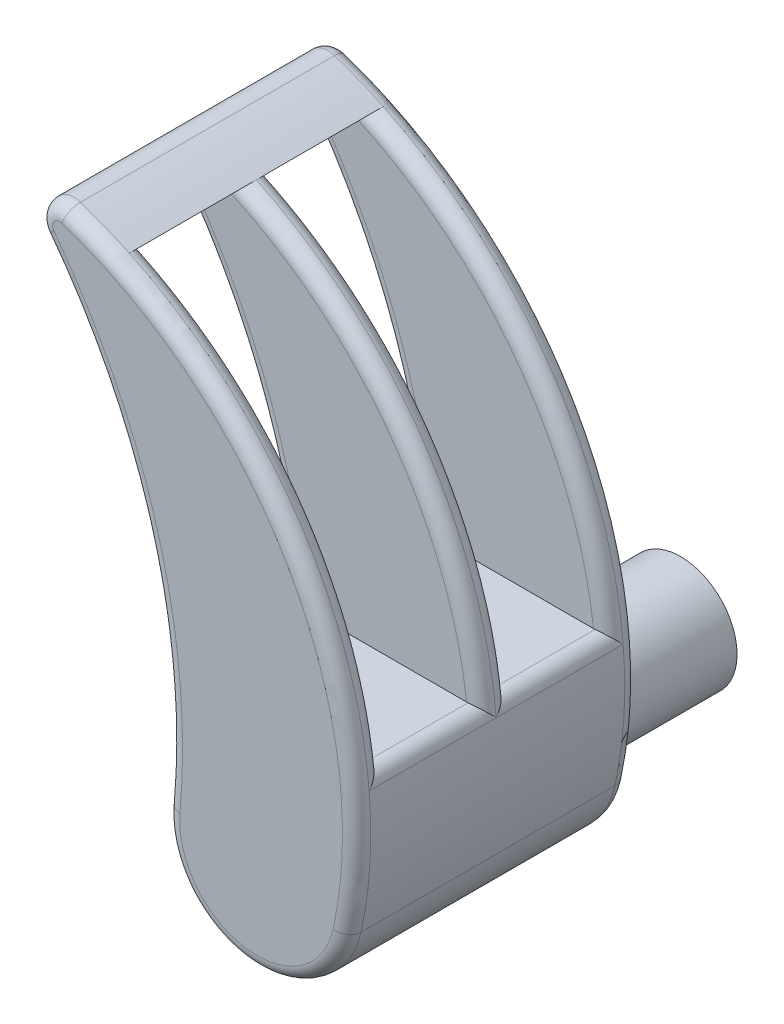
from build123d import *

# Parameters (mm, degrees)
SKETCH1_R                           = 2
BOSS_EXTRUDE1_DEPTH                 = 5
BOSS_EXTRUDE3_DEPTH                 = 10
CUT_EXTRUDE2_REACH                  = 25.802
CUT_EXTRUDE2_END_RADIUS             = 22.1288857330007
CUT_EXTRUDE2_DIRECTION_2_REACH      = 25.802
CUT_EXTRUDE2_DIRECTION_2_END_RADIUS = 14.999999999999998
FILLET5_R                           = 0.5


with BuildPart() as part:
    # Sketch1 → Boss-Extrude1 (new body)
    with BuildSketch(Plane.XY):
        Circle(SKETCH1_R)
    extrude(amount=BOSS_EXTRUDE1_DEPTH)

    # Sketch3 → Boss-Extrude3 (add)
    with BuildSketch(Plane.XY.offset(5)):
        with BuildLine():
            ThreePointArc((3.175585373226926, -0.6914893617021142), (-0.49178216220850224, -3.2125768947892164), (-3.2370218510524773, 0.2901543310185558))
            ThreePointArc((-3.2370218510524773, 0.2901543310185558), (-3.9981573872742686, 8.33829649509967), (-7.599161855032719, 15.576023100943765))
            ThreePointArc((-7.599161855032719, 15.576023100943765), (-7.609248419305821, 16.46453572535497), (-6.7641598682523645, 16.739093120803155))
            ThreePointArc((-6.7641598682523645, 16.739093120803155), (1.5493091336065543, 9.930479195240602), (3.175585373226926, -0.6914893617021142))
        make_face()
    extrude(amount=BOSS_EXTRUDE3_DEPTH)

    # Cut-Extrude2: up to this cylinder (the profile starts outside it)
    cut_extrude2_end = Plane(origin=(-25.277540822488355, 2.2657826498015, 10), z_dir=(0, 0, -1)) * Cylinder(CUT_EXTRUDE2_END_RADIUS, 101.3617714660014, mode=Mode.PRIVATE)
    # Sketch5 → Cut-Extrude2 (cut, up to the surface)
    with BuildSketch(Plane(origin=(0, 0, 0), x_dir=(0, 0, -1), z_dir=(1, 0, 0)), mode=Mode.PRIVATE) as cut_extrude2_sk1:
        Polygon((-13.999999999999998, 16.043695753790985), (-10.499999999999998, 16.043695753790985), (-10.499999999999998, 4.243695753790983), (-13.999999999999996, 4.243695753790984), align=None)
    cut_extrude2_tool1 = extrude(cut_extrude2_sk1.sketch, amount=-CUT_EXTRUDE2_REACH, mode=Mode.PRIVATE) - cut_extrude2_end
    add(cut_extrude2_tool1.solids().sort_by_distance((0, 10.143696, 12.25))[0], mode=Mode.SUBTRACT)
    # Sketch5 → Cut-Extrude2 (cut, up to the surface)
    with BuildSketch(Plane(origin=(0, 0, 0), x_dir=(0, 0, -1), z_dir=(1, 0, 0)), mode=Mode.PRIVATE) as cut_extrude2_sk2:
        Polygon((-9.500000000000002, 16.043695753790985), (-6.000000000000002, 16.04369575379098), (-6, 4.243695753790983), (-9.500000000000002, 4.243695753790983), align=None)
    cut_extrude2_tool2 = extrude(cut_extrude2_sk2.sketch, amount=-CUT_EXTRUDE2_REACH, mode=Mode.PRIVATE) - cut_extrude2_end
    add(cut_extrude2_tool2.solids().sort_by_distance((0, 10.143696, 7.75))[0], mode=Mode.SUBTRACT)

    # Cut-Extrude2 direction 2: up to this cylinder (the profile starts inside it)
    cut_extrude2_direction_2_end = Plane(origin=(-11.480962503205035, 2.5000000000000138, 10), z_dir=(0, 0, -1)) * Cylinder(CUT_EXTRUDE2_DIRECTION_2_END_RADIUS, 87.104, mode=Mode.PRIVATE)
    # Sketch5 → Cut-Extrude2 direction 2 (cut, up to the surface)
    with BuildSketch(Plane(origin=(0, 0, 0), x_dir=(0, 0, -1), z_dir=(1, 0, 0)), mode=Mode.PRIVATE) as cut_extrude2_direction_2_sk1:
        Polygon((-13.999999999999998, 16.043695753790985), (-10.499999999999998, 16.043695753790985), (-10.499999999999998, 4.243695753790983), (-13.999999999999996, 4.243695753790984), align=None)
    cut_extrude2_direction_2_tool1 = extrude(cut_extrude2_direction_2_sk1.sketch, amount=CUT_EXTRUDE2_DIRECTION_2_REACH, mode=Mode.PRIVATE) & cut_extrude2_direction_2_end
    add(cut_extrude2_direction_2_tool1.solids().sort_by_distance((0, 10.143696, 12.25))[0], mode=Mode.SUBTRACT)
    # Sketch5 → Cut-Extrude2 direction 2 (cut, up to the surface)
    with BuildSketch(Plane(origin=(0, 0, 0), x_dir=(0, 0, -1), z_dir=(1, 0, 0)), mode=Mode.PRIVATE) as cut_extrude2_direction_2_sk2:
        Polygon((-9.500000000000002, 16.043695753790985), (-6.000000000000002, 16.04369575379098), (-6, 4.243695753790983), (-9.500000000000002, 4.243695753790983), align=None)
    cut_extrude2_direction_2_tool2 = extrude(cut_extrude2_direction_2_sk2.sketch, amount=CUT_EXTRUDE2_DIRECTION_2_REACH, mode=Mode.PRIVATE) & cut_extrude2_direction_2_end
    add(cut_extrude2_direction_2_tool2.solids().sort_by_distance((0, 10.143696, 7.75))[0], mode=Mode.SUBTRACT)

    # Fillet5
    # the kernel refuses this fillet: 0.5 mm, written as the material it takes off along each edge
    with BuildSketch(Plane(origin=(-7.000000000000001, 16.027138464762995, 14), x_dir=(-0.7988824733769542, -0.6014871517589715, 0), z_dir=(0.6014871517589715, -0.7988824733769542, 0))) as fillet5_piece_1_section:
        with BuildLine():
            CenterArc((0.7500000000000029 - FILLET5_R, -FILLET5_R), FILLET5_R, 0, 90)
            Line((0.7500000000000029 - FILLET5_R, 0), (0.7500000000000029, 0))
            Line((0.7500000000000029, 0), (0.7500000000000029, -FILLET5_R))
        make_face()
    fillet5_piece_1 = revolve(axis=Axis((-7.000000000000001, 16.027138464762995, 14), (0, 0, -1)), revolution_arc=133.74135793171683, mode=Mode.PRIVATE)
    fillet5_piece_1 = split(fillet5_piece_1, bisect_by=Plane(origin=(-7.611530655795485, 16.043695753790985, 14.123559013641222), z_dir=(0, -1, 0)), keep=Keep.TOP, mode=Mode.PRIVATE)
    add(fillet5_piece_1, mode=Mode.SUBTRACT)
    with BuildSketch(Plane(origin=(-7.000000000000001, 16.027138464762995, 6.000000000000002), x_dir=(-0.7988824733769542, -0.6014871517589715, 0), z_dir=(0.6014871517589715, -0.7988824733769542, 0))) as fillet5_piece_2_section:
        with BuildLine():
            CenterArc((0.7500000000000029 - FILLET5_R, FILLET5_R), FILLET5_R, 269.9999999999999, 90.00000000000011)
            Line((0.7500000000000029 - FILLET5_R, 0), (0.7500000000000029, 0))
            Line((0.7500000000000029, 0), (0.7500000000000029, FILLET5_R))
        make_face()
    fillet5_piece_2 = revolve(axis=Axis((-7.000000000000001, 16.027138464762995, 6.000000000000002), (0, 0, -1)), revolution_arc=133.7413579317162, mode=Mode.PRIVATE)
    fillet5_piece_2 = split(fillet5_piece_2, bisect_by=Plane(origin=(-7.611530654842534, 16.04369575379098, 5.876440985070449), z_dir=(0, -1, 1.02e-15)), keep=Keep.TOP, mode=Mode.PRIVATE)
    add(fillet5_piece_2, mode=Mode.SUBTRACT)
    with BuildSketch(Plane(origin=(-7.000000000000001, 16.027138464762995, 9.500000000000002), x_dir=(-0.7988824733769542, -0.6014871517589715, 0), z_dir=(0.6014871517589715, -0.7988824733769542, 0))) as fillet5_piece_3_section:
        with BuildLine():
            CenterArc((0.7500000000000029 - FILLET5_R, -FILLET5_R), FILLET5_R, 0, 90.00000000000013)
            Line((0.7500000000000029 - FILLET5_R, 0), (0.7500000000000029, 0))
            Line((0.7500000000000029, 0), (0.7500000000000029, -FILLET5_R))
        make_face()
    fillet5_piece_3 = revolve(axis=Axis((-7.000000000000001, 16.027138464762995, 9.500000000000002), (0, 0, -1)), revolution_arc=133.7413579317169, mode=Mode.PRIVATE)
    fillet5_piece_3 = split(fillet5_piece_3, bisect_by=Plane(origin=(-7.6115306557954865, 16.043695753790985, 9.623559013641223), z_dir=(0, -1, 1.02e-15)), keep=Keep.TOP, mode=Mode.PRIVATE)
    add(fillet5_piece_3, mode=Mode.SUBTRACT)
    with BuildSketch(Plane(origin=(-7.000000000000001, 16.027138464762995, 10.499999999999998), x_dir=(-0.7988824733769542, -0.6014871517589715, 0), z_dir=(0.6014871517589715, -0.7988824733769542, 0))) as fillet5_piece_4_section:
        with BuildLine():
            CenterArc((0.7500000000000029 - FILLET5_R, FILLET5_R), FILLET5_R, 270, 90)
            Line((0.7500000000000029 - FILLET5_R, 0), (0.7500000000000029, 0))
            Line((0.7500000000000029, 0), (0.7500000000000029, FILLET5_R))
        make_face()
    fillet5_piece_4 = revolve(axis=Axis((-7.000000000000001, 16.027138464762995, 10.499999999999998), (0, 0, -1)), revolution_arc=133.74135793171683, mode=Mode.PRIVATE)
    fillet5_piece_4 = split(fillet5_piece_4, bisect_by=Plane(origin=(-7.611530654842534, 16.043695753790985, 10.376440985070444), z_dir=(0, -1, 0)), keep=Keep.TOP, mode=Mode.PRIVATE)
    add(fillet5_piece_4, mode=Mode.SUBTRACT)
    with BuildSketch(Plane(origin=(-7.000000000000001, 16.027138464762995, 5), x_dir=(-0.7988824733769542, -0.6014871517589715, 0), z_dir=(0.6014871517589715, -0.7988824733769542, 0))) as fillet5_piece_5:
        with BuildLine():
            CenterArc((0.7500000000000029 - FILLET5_R, -FILLET5_R), FILLET5_R, 0, 90.00000000000009)
            Line((0.7500000000000029 - FILLET5_R, 0), (0.7500000000000029, 0))
            Line((0.7500000000000029, 0), (0.7500000000000029, -FILLET5_R))
        make_face()
    revolve(axis=Axis((-7.000000000000001, 16.027138464762995, 5), (0, 0, -1)), revolution_arc=145.30430724960047, mode=Mode.SUBTRACT)
    with BuildSketch(Plane(origin=(-11.480962503205046, 2.4999999999999982, 5), x_dir=(0.3144535089968451, 0.9492728747202097, 0), z_dir=(-0.9492728747202097, 0.3144535089968451, 0))) as fillet5_piece_6:
        with BuildLine():
            CenterArc((15.00000000000001 - FILLET5_R, -FILLET5_R), FILLET5_R, 0, 90)
            Line((15.00000000000001, -FILLET5_R), (15.00000000000001, 0))
            Line((15.00000000000001, 0), (15.00000000000001 - FILLET5_R, 0))
        make_face()
    revolve(axis=Axis((-11.480962503205046, 2.4999999999999982, 5), (0, 0, -1)), revolution_arc=83.95666806488748, mode=Mode.SUBTRACT)
    with BuildSketch(Plane(origin=(-2.44e-15, 4.11e-15, 5), x_dir=(0.9771031917621312, -0.2127659574468055, 0), z_dir=(0.2127659574468055, 0.9771031917621312, 0))) as fillet5_piece_7:
        with BuildLine():
            CenterArc((3.250000000000003 - FILLET5_R, -FILLET5_R), FILLET5_R, 0, 90)
            Line((3.250000000000003 - FILLET5_R, 0), (3.250000000000003, 0))
            Line((3.250000000000003, 0), (3.250000000000003, -FILLET5_R))
        make_face()
    revolve(axis=Axis((-2.44e-15, 4.11e-15, 5), (0, 0, -1)), revolution_arc=172.8375931843419, mode=Mode.SUBTRACT)
    with BuildSketch(Plane(origin=(-2.44e-15, 4.11e-15, 15), x_dir=(0.9771031917621312, -0.2127659574468055, 0), z_dir=(0.2127659574468055, 0.9771031917621312, 0))) as fillet5_piece_8:
        with BuildLine():
            CenterArc((3.250000000000003 - FILLET5_R, FILLET5_R), FILLET5_R, 270, 90)
            Line((3.250000000000003 - FILLET5_R, 0), (3.250000000000003, 0))
            Line((3.250000000000003, 0), (3.250000000000003, FILLET5_R))
        make_face()
    revolve(axis=Axis((-2.44e-15, 4.11e-15, 15), (0, 0, -1)), revolution_arc=172.8375931843419, mode=Mode.SUBTRACT)
    with BuildSketch(Plane(origin=(-25.277540822488493, 2.2657826498014497, 15), x_dir=(0.9960067234007614, -0.08927825569801, 0), z_dir=(-0.08927825569801, -0.9960067234007614, 0))) as fillet5_piece_9:
        with BuildLine():
            CenterArc((22.128885733000832 + FILLET5_R, -FILLET5_R), FILLET5_R, 90, 90)
            Line((22.128885733000832, -FILLET5_R), (22.128885733000832, 0))
            Line((22.128885733000832, 0), (22.128885733000832 + FILLET5_R, 0))
        make_face()
    revolve(axis=Axis((-25.277540822488493, 2.2657826498014497, 15), (0, 0, 1)), revolution_arc=42.09856849882899, mode=Mode.SUBTRACT)
    with BuildSketch(Plane(origin=(-7.000000000000001, 16.027138464762995, 15), x_dir=(-0.7988824733769542, -0.6014871517589715, 0), z_dir=(0.6014871517589715, -0.7988824733769542, 0))) as fillet5_piece_10:
        with BuildLine():
            CenterArc((0.7500000000000029 - FILLET5_R, FILLET5_R), FILLET5_R, 270, 90)
            Line((0.7500000000000029, FILLET5_R), (0.7500000000000029, 0))
            Line((0.7500000000000029, 0), (0.7500000000000029 - FILLET5_R, 0))
        make_face()
    revolve(axis=Axis((-7.000000000000001, 16.027138464762995, 15), (0, 0, -1)), revolution_arc=145.30430724960047, mode=Mode.SUBTRACT)
    with BuildSketch(Plane(origin=(-11.480962503205046, 2.4999999999999982, 15), x_dir=(0.3144535089968451, 0.9492728747202097, 0), z_dir=(-0.9492728747202097, 0.3144535089968451, 0))) as fillet5_piece_11:
        with BuildLine():
            CenterArc((15.00000000000001 - FILLET5_R, FILLET5_R), FILLET5_R, 270, 90)
            Line((15.00000000000001, FILLET5_R), (15.00000000000001, 0))
            Line((15.00000000000001, 0), (15.00000000000001 - FILLET5_R, 0))
        make_face()
    revolve(axis=Axis((-11.480962503205046, 2.4999999999999982, 15), (0, 0, -1)), revolution_arc=83.95666806488748, mode=Mode.SUBTRACT)
    with BuildSketch(Plane(origin=(-25.277540822488355, 2.2657826498015, 13.999999999999993), x_dir=(0.7988824733769484, 0.601487151758979, 0), z_dir=(-0.601487151758979, 0.7988824733769484, 0))) as fillet5_piece_12_section:
        with BuildLine():
            CenterArc((22.1288857330007 + FILLET5_R, -FILLET5_R), FILLET5_R, 90, 89.99999999999937)
            Line((22.128885733000697, -FILLET5_R), (22.1288857330007, 0))
            Line((22.1288857330007, 0), (22.1288857330007 + FILLET5_R, -5.33e-15))
        make_face()
    fillet5_piece_12 = revolve(axis=Axis((-25.277540822488355, 2.2657826498015, 13.999999999999993), (0, 0, -1)), revolution_arc=35.085098986813165, mode=Mode.PRIVATE)
    fillet5_piece_12 = split(fillet5_piece_12, bisect_by=Plane(origin=(-4.487192939140403, 4.243695753790984, 14.139913107038728), z_dir=(0, 1, -2.5e-16)), keep=Keep.TOP, mode=Mode.PRIVATE)
    add(fillet5_piece_12, mode=Mode.SUBTRACT)
    with BuildSketch(Plane(origin=(-3.2372267698876485, 4.243695753790983, 10.850645451248859), x_dir=(1, 0, 0), z_dir=(0, 0, -1))) as fillet5_piece_13_section:
        with BuildLine():
            CenterArc((0.5402581804995541, 0.5), FILLET5_R, 176.2552951332616, 93.7447048667384)
            ThreePointArc((0.04132569881376735, 0.5326554546571032), (0.02227039096021244, 0.26620300734777746), (0, 0))
            Line((0, 0), (0.5402581804995541, 0))
        make_face()
    fillet5_piece_13 = extrude(amount=4.850645451248859, mode=Mode.PRIVATE)
    fillet5_piece_13 = split(fillet5_piece_13, bisect_by=Plane(origin=(-3.1030928035067022, 4.121993177956135, 10.499999999999998), z_dir=(0, 0, 1)), keep=Keep.TOP, mode=Mode.PRIVATE)
    add(fillet5_piece_13, mode=Mode.SUBTRACT)
    with BuildSketch(Plane(origin=(-3.237226769887638, 4.243695753790983, 9.5), x_dir=(1, 0, 0), z_dir=(0, 0, -1))) as fillet5_piece_14:
        with BuildLine():
            CenterArc((0.5402581804995434, 0.5), FILLET5_R, 176.2552951332616, 93.7447048667384)
            ThreePointArc((0.04132569881375669, 0.5326554546571032), (0.02227039096020178, 0.26620300734777746), (0, 0))
            Line((0, 0), (0.5402581804995434, 0))
        make_face()
    extrude(amount=3.5, mode=Mode.SUBTRACT)
    with BuildSketch(Plane(origin=(-3.237226769887638, 4.2436957537909965, 13.999999999999993), x_dir=(1, -2.302e-14, 0), z_dir=(0, 0, -1))) as fillet5_piece_15:
        with BuildLine():
            CenterArc((0.540258180499555, 0.5), FILLET5_R, 176.2552951332603, 93.7447048667384)
            ThreePointArc((0.04132569881376896, 0.5326554546571146), (0.02227039096020791, 0.26620300734778407), (0, 0))
            Line((0, 0), (0.5402581804995434, 0))
        make_face()
    extrude(amount=3.499999999999993, mode=Mode.SUBTRACT)
    with BuildSketch(Plane(origin=(-3.237226769887638, 4.2436957537909965, 13.999999999999993), x_dir=(1, -2.302e-14, 0), z_dir=(0, 0, -1))) as fillet5_piece_16_section:
        with BuildLine():
            CenterArc((0.540258180499555, 0.5), FILLET5_R, 176.2552951332603, 93.7447048667384)
            ThreePointArc((0.04132569881376896, 0.5326554546571146), (0.02227039096020791, 0.26620300734778407), (0, 0))
            Line((0, 0), (0.5402581804995434, 0))
        make_face()
    fillet5_piece_16 = extrude(amount=4.850645451248852, mode=Mode.PRIVATE)
    fillet5_piece_16 = split(fillet5_piece_16, bisect_by=Plane(origin=(-3.103092803506703, 4.121993177956135, 9.500000000000002), z_dir=(0, 0, -1)), keep=Keep.TOP, mode=Mode.PRIVATE)
    add(fillet5_piece_16, mode=Mode.SUBTRACT)
    with BuildSketch(Plane(origin=(-11.480962503205035, 2.5000000000000138, 13.999999999999993), x_dir=(0.9994501704300607, 0.03315655029285667, 0), z_dir=(0.03315655029285667, -0.9994501704300607, 0))) as fillet5_piece_17_section:
        with BuildLine():
            CenterArc((14.999999999999998 - FILLET5_R, FILLET5_R), FILLET5_R, 270, 89.99999999999999)
            Line((14.999999999999998, FILLET5_R), (14.999999999999998, 0))
            Line((14.999999999999998, 0), (14.999999999999998 - FILLET5_R, 1.2e-16))
        make_face()
    fillet5_piece_17 = revolve(axis=Axis((-11.480962503205035, 2.5000000000000138, 13.999999999999993), (-2.8e-16, 3.3e-16, 1)), revolution_arc=67.41901898538889, mode=Mode.PRIVATE)
    fillet5_piece_17 = split(fillet5_piece_17, bisect_by=Plane(origin=(0.24921992587161534, 4.243695753790984, 14.139438862609827), z_dir=(0, 1, -2.5e-16)), keep=Keep.TOP, mode=Mode.PRIVATE)
    fillet5_piece_17 = split(fillet5_piece_17, bisect_by=Plane(origin=(0.24921992587161534, 16.043695753790985, 14.139438862609826), z_dir=(0, -1, 0)), keep=Keep.TOP, mode=Mode.PRIVATE)
    add(fillet5_piece_17, mode=Mode.SUBTRACT)
    with BuildSketch(Plane(origin=(3.4173436125321253, 4.243695753790983, 10.648661073440266), x_dir=(-1, 0, 0), z_dir=(0, 0, -1))) as fillet5_piece_18_section:
        with BuildLine():
            CenterArc((0.4517417881192407, -0.5), FILLET5_R, 90, 85.07957370086908)
            ThreePointArc((-0.04641560248827359, -0.45711393952444945), (-0.02495813385291434, -0.22837924002010368), (0, 0))
            Line((0, 0), (0.4517417881192407, 0))
        make_face()
    fillet5_piece_18 = extrude(amount=4.648661073440266, mode=Mode.PRIVATE)
    fillet5_piece_18 = split(fillet5_piece_18, bisect_by=Plane(origin=(3.3278097479019624, 4.141168751528584, 10.499999999999998), z_dir=(0, 0, 1)), keep=Keep.TOP, mode=Mode.PRIVATE)
    add(fillet5_piece_18, mode=Mode.SUBTRACT)
    with BuildSketch(Plane(origin=(3.4173436125321253, 4.243695753790983, 9.5), x_dir=(-1, 0, 0), z_dir=(0, 0, -1))) as fillet5_piece_19:
        with BuildLine():
            CenterArc((0.4517417881192407, -0.5), FILLET5_R, 90, 85.07957370086908)
            ThreePointArc((-0.04641560248827359, -0.45711393952444945), (-0.02495813385291434, -0.22837924002010368), (0, 0))
            Line((0, 0), (0.4517417881192407, 0))
        make_face()
    extrude(amount=3.5, mode=Mode.SUBTRACT)
    with BuildSketch(Plane(origin=(3.4173436125321253, 4.243695753790995, 13.999999999999993), x_dir=(-1, -2.359e-14, 0), z_dir=(0, 0, -1))) as fillet5_piece_20:
        with BuildLine():
            CenterArc((0.4517417881192534, -0.5), FILLET5_R, 90.00000000000136, 85.07957370086925)
            ThreePointArc((-0.04641560248826192, -0.45711393952446255), (-0.02495813385290896, -0.22837924002011314), (0, 0))
            Line((0, 0), (0.4517417881192416, 0))
        make_face()
    extrude(amount=3.499999999999993, mode=Mode.SUBTRACT)
    with BuildSketch(Plane(origin=(3.4173436125321253, 4.243695753790995, 13.999999999999993), x_dir=(-1, -2.359e-14, 0), z_dir=(0, 0, -1))) as fillet5_piece_21_section:
        with BuildLine():
            CenterArc((0.4517417881192534, -0.5), FILLET5_R, 90.00000000000136, 85.07957370086925)
            ThreePointArc((-0.04641560248826192, -0.45711393952446255), (-0.02495813385290896, -0.22837924002011314), (0, 0))
            Line((0, 0), (0.4517417881192416, 0))
        make_face()
    fillet5_piece_21 = extrude(amount=4.648661073440287, mode=Mode.PRIVATE)
    fillet5_piece_21 = split(fillet5_piece_21, bisect_by=Plane(origin=(3.3278097479019615, 4.141168751528585, 9.500000000000002), z_dir=(0, 0, -1)), keep=Keep.TOP, mode=Mode.PRIVATE)
    add(fillet5_piece_21, mode=Mode.SUBTRACT)
    with BuildSketch(Plane(origin=(-11.480962503205046, 2.4999999999999982, 10.499999999999998), x_dir=(0.3531630251495664, 0.9355617978878822, 0), z_dir=(-0.9355617978878822, 0.3531630251495664, 0))) as fillet5_piece_22_section:
        with BuildLine():
            CenterArc((15.000000000000009 - FILLET5_R, FILLET5_R), FILLET5_R, 270, 90)
            Line((15.000000000000009, FILLET5_R), (15.000000000000009, 0))
            Line((15.000000000000009, 0), (15.000000000000009 - FILLET5_R, 0))
        make_face()
    fillet5_piece_22 = revolve(axis=Axis((-11.480962503205046, 2.4999999999999982, 10.499999999999998), (0, 0, -1)), revolution_arc=67.41901898538882, mode=Mode.PRIVATE)
    fillet5_piece_22 = split(fillet5_piece_22, bisect_by=Plane(origin=(0.24921991530193388, 4.243695753790983, 10.360561123999826), z_dir=(0, 1, -2.5e-16)), keep=Keep.TOP, mode=Mode.PRIVATE)
    fillet5_piece_22 = split(fillet5_piece_22, bisect_by=Plane(origin=(0.24921991530193388, 16.043695753790985, 10.360561123999824), z_dir=(0, -1, 0)), keep=Keep.TOP, mode=Mode.PRIVATE)
    add(fillet5_piece_22, mode=Mode.SUBTRACT)
    with BuildSketch(Plane(origin=(-11.480962503205035, 2.5000000000000138, 9.5), x_dir=(0.9994501704300607, 0.033156550292856586, 0), z_dir=(0.033156550292856586, -0.9994501704300607, 0))) as fillet5_piece_23_section:
        with BuildLine():
            CenterArc((14.999999999999998 - FILLET5_R, FILLET5_R), FILLET5_R, 270, 89.99999999999999)
            Line((14.999999999999998, FILLET5_R), (14.999999999999998, 0))
            Line((14.999999999999998, 0), (14.999999999999998 - FILLET5_R, 6e-17))
        make_face()
    fillet5_piece_23 = revolve(axis=Axis((-11.480962503205035, 2.5000000000000138, 9.5), (-1.4e-16, 1.6e-16, 1)), revolution_arc=67.41901898538889, mode=Mode.PRIVATE)
    fillet5_piece_23 = split(fillet5_piece_23, bisect_by=Plane(origin=(0.2492199258716135, 4.243695753790983, 9.639438862609833), z_dir=(0, 1, 0)), keep=Keep.TOP, mode=Mode.PRIVATE)
    fillet5_piece_23 = split(fillet5_piece_23, bisect_by=Plane(origin=(0.2492199258716135, 16.043695753790985, 9.639438862609829), z_dir=(0, -1, 1.02e-15)), keep=Keep.TOP, mode=Mode.PRIVATE)
    add(fillet5_piece_23, mode=Mode.SUBTRACT)
    with BuildSketch(Plane(origin=(-11.480962503205046, 2.4999999999999982, 5.999999999999999), x_dir=(0.35316302514956677, 0.9355617978878821, 0), z_dir=(-0.9355617978878821, 0.35316302514956677, 0))) as fillet5_piece_24_section:
        with BuildLine():
            CenterArc((15.000000000000007 - FILLET5_R, FILLET5_R), FILLET5_R, 270, 90.00000000000001)
            Line((15.000000000000007, FILLET5_R), (15.000000000000007, 8.9e-16))
            Line((15.000000000000007, 8.9e-16), (15.000000000000007 - FILLET5_R, 7.7e-16))
        make_face()
    fillet5_piece_24 = revolve(axis=Axis((-11.480962503205046, 2.4999999999999982, 5.999999999999999), (-2.8e-16, 3.3e-16, -1)), revolution_arc=67.41901898538876, mode=Mode.PRIVATE)
    fillet5_piece_24 = split(fillet5_piece_24, bisect_by=Plane(origin=(0.24921991530194268, 4.243695753790983, 5.8605611239998225), z_dir=(0, 1, 0)), keep=Keep.TOP, mode=Mode.PRIVATE)
    fillet5_piece_24 = split(fillet5_piece_24, bisect_by=Plane(origin=(0.24921991530194268, 16.04369575379098, 5.860561123999818), z_dir=(0, -1, 1.02e-15)), keep=Keep.TOP, mode=Mode.PRIVATE)
    add(fillet5_piece_24, mode=Mode.SUBTRACT)
    with BuildSketch(Plane(origin=(-25.277540822488355, 2.2657826498015, 6), x_dir=(0.7988824733769484, 0.601487151758979, 0), z_dir=(-0.601487151758979, 0.7988824733769484, 0))) as fillet5_piece_25_section:
        with BuildLine():
            CenterArc((22.1288857330007 + FILLET5_R, FILLET5_R), FILLET5_R, 179.9999999999998, 90.00000000000023)
            Line((22.1288857330007, FILLET5_R), (22.1288857330007, 0))
            Line((22.1288857330007, 0), (22.1288857330007 + FILLET5_R, -1.78e-15))
        make_face()
    fillet5_piece_25 = revolve(axis=Axis((-25.277540822488355, 2.2657826498015, 6), (0, 0, -1)), revolution_arc=35.08509898681317, mode=Mode.PRIVATE)
    fillet5_piece_25 = split(fillet5_piece_25, bisect_by=Plane(origin=(-4.487192939198946, 4.243695753790983, 5.860086893023969), z_dir=(0, 1, 0)), keep=Keep.TOP, mode=Mode.PRIVATE)
    add(fillet5_piece_25, mode=Mode.SUBTRACT)
    with BuildSketch(Plane(origin=(-25.277540822488355, 2.2657826498015, 9.5), x_dir=(0.7988824733769484, 0.601487151758979, 0), z_dir=(-0.601487151758979, 0.7988824733769484, 0))) as fillet5_piece_26_section:
        with BuildLine():
            CenterArc((22.1288857330007 + FILLET5_R, -FILLET5_R), FILLET5_R, 90, 89.9999999999998)
            Line((22.128885733000697, -FILLET5_R), (22.1288857330007, 0))
            Line((22.1288857330007, 0), (22.1288857330007 + FILLET5_R, -1.78e-15))
        make_face()
    fillet5_piece_26 = revolve(axis=Axis((-25.277540822488355, 2.2657826498015, 9.5), (0, 0, -1)), revolution_arc=35.085098986813165, mode=Mode.PRIVATE)
    fillet5_piece_26 = split(fillet5_piece_26, bisect_by=Plane(origin=(-4.487192939140407, 4.243695753790983, 9.639913107038733), z_dir=(0, 1, 0)), keep=Keep.TOP, mode=Mode.PRIVATE)
    add(fillet5_piece_26, mode=Mode.SUBTRACT)
    with BuildSketch(Plane(origin=(-25.277540822488355, 2.2657826498015, 10.5), x_dir=(0.7988824733769484, 0.601487151758979, 0), z_dir=(-0.601487151758979, 0.7988824733769484, 0))) as fillet5_piece_27_section:
        with BuildLine():
            CenterArc((22.1288857330007 + FILLET5_R, FILLET5_R), FILLET5_R, 180.0000000000002, 89.99999999999977)
            Line((22.128885733000697, FILLET5_R), (22.1288857330007, 0))
            Line((22.1288857330007, 0), (22.1288857330007 + FILLET5_R, 1.78e-15))
        make_face()
    fillet5_piece_27 = revolve(axis=Axis((-25.277540822488355, 2.2657826498015, 10.5), (0, 0, -1)), revolution_arc=35.085098986813165, mode=Mode.PRIVATE)
    fillet5_piece_27 = split(fillet5_piece_27, bisect_by=Plane(origin=(-4.487192939198946, 4.243695753790983, 10.360086893023968), z_dir=(0, 1, -2.5e-16)), keep=Keep.TOP, mode=Mode.PRIVATE)
    add(fillet5_piece_27, mode=Mode.SUBTRACT)
    with BuildSketch(Plane(origin=(-25.277540822488493, 2.2657826498014497, 5), x_dir=(0.9960067234007614, -0.08927825569801, 0), z_dir=(-0.08927825569801, -0.9960067234007614, 0))) as fillet5_piece_28:
        with BuildLine():
            CenterArc((22.128885733000832 + FILLET5_R, FILLET5_R), FILLET5_R, 180, 90)
            Line((22.128885733000832, FILLET5_R), (22.128885733000832, 0))
            Line((22.128885733000832, 0), (22.128885733000832 + FILLET5_R, 0))
        make_face()
    revolve(axis=Axis((-25.277540822488493, 2.2657826498014497, 5), (0, 0, 1)), revolution_arc=42.09856849882899, mode=Mode.SUBTRACT)
    with BuildSketch(Plane(origin=(-3.2372267698876485, 4.243695753790984, 15.350645451248852), x_dir=(1, 0, 0), z_dir=(0, 0, -1))) as fillet5_piece_29a_section:
        with BuildLine():
            CenterArc((0.5402581804995541, 0.5), FILLET5_R, 176.25529513326165, 93.74470486673835)
            ThreePointArc((0.04132569881376735, 0.5326554546571027), (0.02227039096021244, 0.26620300734777746), (0, 0))
            Line((0, 0), (0.5402581804995541, 0))
        make_face()
    fillet5_piece_29a = extrude(amount=4.850645451248852, mode=Mode.PRIVATE)
    fillet5_piece_29a = split(fillet5_piece_29a, bisect_by=Plane(origin=(-3.103092803506703, 4.121993177956135, 13.999999999999996), z_dir=(0, -1.5e-16, 1)), keep=Keep.TOP, mode=Mode.PRIVATE)
    with BuildSketch(Plane(origin=(-25.277540822488355, 2.2657826498015, 13.999999999999993), x_dir=(0.7988824733769484, 0.601487151758979, 0), z_dir=(-0.601487151758979, 0.7988824733769484, 0))) as fillet5_piece_29b_section:
        with BuildLine():
            CenterArc((22.1288857330007 + FILLET5_R, -FILLET5_R), FILLET5_R, 90, 89.99999999999937)
            Line((22.128885733000697, -FILLET5_R), (22.1288857330007, 0))
            Line((22.1288857330007, 0), (22.1288857330007 + FILLET5_R, -5.33e-15))
        make_face()
    fillet5_piece_29b = revolve(axis=Axis((-25.277540822488355, 2.2657826498015, 13.999999999999993), (0, 0, -1)), revolution_arc=35.085098986813165, mode=Mode.PRIVATE)
    fillet5_piece_29b = split(fillet5_piece_29b, bisect_by=Plane(origin=(-3.080078676651646, 4.243695753790984, 14.113380663874185), z_dir=(0, -1, 2.5e-16)), keep=Keep.TOP, mode=Mode.PRIVATE)
    fillet5_piece_29 = fillet5_piece_29a & fillet5_piece_29b
    add(fillet5_piece_29, mode=Mode.SUBTRACT)
    with BuildSketch(Plane(origin=(-3.2372267698876485, 4.243695753790983, 10.850645451248859), x_dir=(1, 0, 0), z_dir=(0, 0, -1))) as fillet5_piece_30a_section:
        with BuildLine():
            CenterArc((0.5402581804995541, 0.5), FILLET5_R, 176.2552951332616, 93.7447048667384)
            ThreePointArc((0.04132569881376735, 0.5326554546571032), (0.02227039096021244, 0.26620300734777746), (0, 0))
            Line((0, 0), (0.5402581804995541, 0))
        make_face()
    fillet5_piece_30a = extrude(amount=4.850645451248859, mode=Mode.PRIVATE)
    fillet5_piece_30a = split(fillet5_piece_30a, bisect_by=Plane(origin=(-3.1030928035067027, 4.121993177956135, 9.500000000000002), z_dir=(0, 0, 1)), keep=Keep.TOP, mode=Mode.PRIVATE)
    fillet5_piece_30a = split(fillet5_piece_30a, bisect_by=Plane(origin=(-3.1030928035067027, 4.121993177956135, 10.499999999999998), z_dir=(0, 0, -1)), keep=Keep.TOP, mode=Mode.PRIVATE)
    with BuildSketch(Plane(origin=(-25.277540822488355, 2.2657826498015, 9.5), x_dir=(0.7988824733769484, 0.601487151758979, 0), z_dir=(-0.601487151758979, 0.7988824733769484, 0))) as fillet5_piece_30b_section:
        with BuildLine():
            CenterArc((22.1288857330007 + FILLET5_R, -FILLET5_R), FILLET5_R, 90, 89.9999999999998)
            Line((22.128885733000697, -FILLET5_R), (22.1288857330007, 0))
            Line((22.1288857330007, 0), (22.1288857330007 + FILLET5_R, -1.78e-15))
        make_face()
    fillet5_piece_30b = revolve(axis=Axis((-25.277540822488355, 2.2657826498015, 9.5), (0, 0, -1)), revolution_arc=35.085098986813165, mode=Mode.PRIVATE)
    fillet5_piece_30b = split(fillet5_piece_30b, bisect_by=Plane(origin=(-3.080078676651648, 4.243695753790983, 9.61338066387419), z_dir=(0, -1, 0)), keep=Keep.TOP, mode=Mode.PRIVATE)
    fillet5_piece_30 = fillet5_piece_30a & fillet5_piece_30b
    add(fillet5_piece_30, mode=Mode.SUBTRACT)
    with BuildSketch(Plane(origin=(-25.277540822488355, 2.2657826498015, 6), x_dir=(0.7988824733769484, 0.601487151758979, 0), z_dir=(-0.601487151758979, 0.7988824733769484, 0))) as fillet5_piece_31a_section:
        with BuildLine():
            CenterArc((22.1288857330007 + FILLET5_R, FILLET5_R), FILLET5_R, 179.9999999999998, 90.00000000000023)
            Line((22.1288857330007, FILLET5_R), (22.1288857330007, 0))
            Line((22.1288857330007, 0), (22.1288857330007 + FILLET5_R, -1.78e-15))
        make_face()
    fillet5_piece_31a = revolve(axis=Axis((-25.277540822488355, 2.2657826498015, 6), (0, 0, -1)), revolution_arc=35.08509898681317, mode=Mode.PRIVATE)
    fillet5_piece_31a = split(fillet5_piece_31a, bisect_by=Plane(origin=(-3.0800786745854087, 4.243695753790983, 5.8866193324274185), z_dir=(0, -1, 0)), keep=Keep.TOP, mode=Mode.PRIVATE)
    with BuildSketch(Plane(origin=(-3.237226769887638, 4.243695753790983, 9.5), x_dir=(1, 0, 0), z_dir=(0, 0, -1))) as fillet5_piece_31b_section:
        with BuildLine():
            CenterArc((0.5402581804995434, 0.5), FILLET5_R, 176.2552951332616, 93.7447048667384)
            ThreePointArc((0.04132569881375669, 0.5326554546571032), (0.02227039096020178, 0.26620300734777746), (0, 0))
            Line((0, 0), (0.5402581804995434, 0))
        make_face()
    fillet5_piece_31b = extrude(amount=4.850645451248859, mode=Mode.PRIVATE)
    fillet5_piece_31b = split(fillet5_piece_31b, bisect_by=Plane(origin=(-3.1030928035067022, 4.121993177956135, 6), z_dir=(0, 1.5e-16, -1)), keep=Keep.TOP, mode=Mode.PRIVATE)
    fillet5_piece_31 = fillet5_piece_31a & fillet5_piece_31b
    add(fillet5_piece_31, mode=Mode.SUBTRACT)
    with BuildSketch(Plane(origin=(-25.277540822488355, 2.2657826498015, 10.5), x_dir=(0.7988824733769484, 0.601487151758979, 0), z_dir=(-0.601487151758979, 0.7988824733769484, 0))) as fillet5_piece_32a_section:
        with BuildLine():
            CenterArc((22.1288857330007 + FILLET5_R, FILLET5_R), FILLET5_R, 180.0000000000002, 89.99999999999977)
            Line((22.128885733000697, FILLET5_R), (22.1288857330007, 0))
            Line((22.1288857330007, 0), (22.1288857330007 + FILLET5_R, 1.78e-15))
        make_face()
    fillet5_piece_32a = revolve(axis=Axis((-25.277540822488355, 2.2657826498015, 10.5), (0, 0, -1)), revolution_arc=35.085098986813165, mode=Mode.PRIVATE)
    fillet5_piece_32a = split(fillet5_piece_32a, bisect_by=Plane(origin=(-3.0800786745854185, 4.243695753790983, 10.38661933242741), z_dir=(0, -1, 2.5e-16)), keep=Keep.TOP, mode=Mode.PRIVATE)
    with BuildSketch(Plane(origin=(-3.237226769887638, 4.2436957537909965, 13.999999999999993), x_dir=(1, -2.302e-14, 0), z_dir=(0, 0, -1))) as fillet5_piece_32b_section:
        with BuildLine():
            CenterArc((0.540258180499555, 0.5), FILLET5_R, 176.2552951332603, 93.7447048667384)
            ThreePointArc((0.04132569881376896, 0.5326554546571146), (0.02227039096020791, 0.26620300734778407), (0, 0))
            Line((0, 0), (0.5402581804995434, 0))
        make_face()
    fillet5_piece_32b = extrude(amount=4.850645451248852, mode=Mode.PRIVATE)
    fillet5_piece_32b = split(fillet5_piece_32b, bisect_by=Plane(origin=(-3.103092803506703, 4.121993177956135, 9.500000000000002), z_dir=(0, 0, 1)), keep=Keep.TOP, mode=Mode.PRIVATE)
    fillet5_piece_32b = split(fillet5_piece_32b, bisect_by=Plane(origin=(-3.103092803506703, 4.121993177956135, 10.499999999999998), z_dir=(0, 0, -1)), keep=Keep.TOP, mode=Mode.PRIVATE)
    fillet5_piece_32 = fillet5_piece_32a & fillet5_piece_32b
    add(fillet5_piece_32, mode=Mode.SUBTRACT)
    with BuildSketch(Plane(origin=(3.4173436125321253, 4.243695753790984, 15.148661073440287), x_dir=(-1, 0, 0), z_dir=(0, 0, -1))) as fillet5_piece_33a_section:
        with BuildLine():
            CenterArc((0.4517417881192407, -0.5), FILLET5_R, 90, 85.07957370086919)
            ThreePointArc((-0.04641560248827359, -0.45711393952445034), (-0.02495813385291434, -0.22837924002010457), (0, 0))
            Line((0, 0), (0.4517417881192407, 0))
        make_face()
    fillet5_piece_33a = extrude(amount=4.648661073440287, mode=Mode.PRIVATE)
    fillet5_piece_33a = split(fillet5_piece_33a, bisect_by=Plane(origin=(3.3278097479019615, 4.141168751528585, 13.999999999999996), z_dir=(0, -1.5e-16, 1)), keep=Keep.TOP, mode=Mode.PRIVATE)
    with BuildSketch(Plane(origin=(-11.480962503205035, 2.5000000000000138, 13.999999999999993), x_dir=(0.9994501704300607, 0.03315655029285667, 0), z_dir=(0.03315655029285667, -0.9994501704300607, 0))) as fillet5_piece_33b_section:
        with BuildLine():
            CenterArc((14.999999999999998 - FILLET5_R, FILLET5_R), FILLET5_R, 270, 89.99999999999999)
            Line((14.999999999999998, FILLET5_R), (14.999999999999998, 0))
            Line((14.999999999999998, 0), (14.999999999999998 - FILLET5_R, 1.2e-16))
        make_face()
    fillet5_piece_33b = revolve(axis=Axis((-11.480962503205035, 2.5000000000000138, 13.999999999999993), (-2.8e-16, 3.3e-16, 1)), revolution_arc=67.41901898538889, mode=Mode.PRIVATE)
    fillet5_piece_33b = split(fillet5_piece_33b, bisect_by=Plane(origin=(3.35897238233696, 4.243695753790984, 14.11301298570383), z_dir=(0, -1, 2.5e-16)), keep=Keep.TOP, mode=Mode.PRIVATE)
    fillet5_piece_33 = fillet5_piece_33a & fillet5_piece_33b
    add(fillet5_piece_33, mode=Mode.SUBTRACT)
    with BuildSketch(Plane(origin=(3.4173436125321253, 4.243695753790983, 10.648661073440266), x_dir=(-1, 0, 0), z_dir=(0, 0, -1))) as fillet5_piece_34a_section:
        with BuildLine():
            CenterArc((0.4517417881192407, -0.5), FILLET5_R, 90, 85.07957370086908)
            ThreePointArc((-0.04641560248827359, -0.45711393952444945), (-0.02495813385291434, -0.22837924002010368), (0, 0))
            Line((0, 0), (0.4517417881192407, 0))
        make_face()
    fillet5_piece_34a = extrude(amount=4.648661073440266, mode=Mode.PRIVATE)
    fillet5_piece_34a = split(fillet5_piece_34a, bisect_by=Plane(origin=(3.327809747901963, 4.141168751528582, 9.500000000000002), z_dir=(0, 0, 1)), keep=Keep.TOP, mode=Mode.PRIVATE)
    fillet5_piece_34a = split(fillet5_piece_34a, bisect_by=Plane(origin=(3.327809747901963, 4.141168751528582, 10.499999999999998), z_dir=(0, 0, -1)), keep=Keep.TOP, mode=Mode.PRIVATE)
    with BuildSketch(Plane(origin=(-11.480962503205035, 2.5000000000000138, 9.5), x_dir=(0.9994501704300607, 0.033156550292856586, 0), z_dir=(0.033156550292856586, -0.9994501704300607, 0))) as fillet5_piece_34b_section:
        with BuildLine():
            CenterArc((14.999999999999998 - FILLET5_R, FILLET5_R), FILLET5_R, 270, 89.99999999999999)
            Line((14.999999999999998, FILLET5_R), (14.999999999999998, 0))
            Line((14.999999999999998, 0), (14.999999999999998 - FILLET5_R, 6e-17))
        make_face()
    fillet5_piece_34b = revolve(axis=Axis((-11.480962503205035, 2.5000000000000138, 9.5), (-1.4e-16, 1.6e-16, 1)), revolution_arc=67.41901898538889, mode=Mode.PRIVATE)
    fillet5_piece_34b = split(fillet5_piece_34b, bisect_by=Plane(origin=(3.3589723823369595, 4.243695753790983, 9.613012985703838), z_dir=(0, -1, 0)), keep=Keep.TOP, mode=Mode.PRIVATE)
    fillet5_piece_34 = fillet5_piece_34a & fillet5_piece_34b
    add(fillet5_piece_34, mode=Mode.SUBTRACT)
    with BuildSketch(Plane(origin=(-11.480962503205046, 2.4999999999999982, 5.999999999999999), x_dir=(0.35316302514956677, 0.9355617978878821, 0), z_dir=(-0.9355617978878821, 0.35316302514956677, 0))) as fillet5_piece_35a_section:
        with BuildLine():
            CenterArc((15.000000000000007 - FILLET5_R, FILLET5_R), FILLET5_R, 270, 90.00000000000001)
            Line((15.000000000000007, FILLET5_R), (15.000000000000007, 8.9e-16))
            Line((15.000000000000007, 8.9e-16), (15.000000000000007 - FILLET5_R, 7.7e-16))
        make_face()
    fillet5_piece_35a = revolve(axis=Axis((-11.480962503205046, 2.4999999999999982, 5.999999999999999), (-2.8e-16, 3.3e-16, -1)), revolution_arc=67.41901898538876, mode=Mode.PRIVATE)
    fillet5_piece_35a = split(fillet5_piece_35a, bisect_by=Plane(origin=(3.3589726633911914, 4.243695753790983, 5.886986952573124), z_dir=(0, -1, 0)), keep=Keep.TOP, mode=Mode.PRIVATE)
    with BuildSketch(Plane(origin=(3.4173436125321253, 4.243695753790983, 9.5), x_dir=(-1, 0, 0), z_dir=(0, 0, -1))) as fillet5_piece_35b_section:
        with BuildLine():
            CenterArc((0.4517417881192407, -0.5), FILLET5_R, 90, 85.07957370086908)
            ThreePointArc((-0.04641560248827359, -0.45711393952444945), (-0.02495813385291434, -0.22837924002010368), (0, 0))
            Line((0, 0), (0.4517417881192407, 0))
        make_face()
    fillet5_piece_35b = extrude(amount=4.648661073440266, mode=Mode.PRIVATE)
    fillet5_piece_35b = split(fillet5_piece_35b, bisect_by=Plane(origin=(3.327809747901962, 4.141168751528582, 6), z_dir=(0, 1.5e-16, -1)), keep=Keep.TOP, mode=Mode.PRIVATE)
    fillet5_piece_35 = fillet5_piece_35a & fillet5_piece_35b
    add(fillet5_piece_35, mode=Mode.SUBTRACT)
    with BuildSketch(Plane(origin=(-11.480962503205046, 2.4999999999999982, 10.499999999999998), x_dir=(0.3531630251495664, 0.9355617978878822, 0), z_dir=(-0.9355617978878822, 0.3531630251495664, 0))) as fillet5_piece_36a_section:
        with BuildLine():
            CenterArc((15.000000000000009 - FILLET5_R, FILLET5_R), FILLET5_R, 270, 90)
            Line((15.000000000000009, FILLET5_R), (15.000000000000009, 0))
            Line((15.000000000000009, 0), (15.000000000000009 - FILLET5_R, 0))
        make_face()
    fillet5_piece_36a = revolve(axis=Axis((-11.480962503205046, 2.4999999999999982, 10.499999999999998), (0, 0, -1)), revolution_arc=67.41901898538882, mode=Mode.PRIVATE)
    fillet5_piece_36a = split(fillet5_piece_36a, bisect_by=Plane(origin=(3.358972663391186, 4.243695753790983, 10.386986952573128), z_dir=(0, -1, 2.5e-16)), keep=Keep.TOP, mode=Mode.PRIVATE)
    with BuildSketch(Plane(origin=(3.4173436125321253, 4.243695753790995, 13.999999999999993), x_dir=(-1, -2.359e-14, 0), z_dir=(0, 0, -1))) as fillet5_piece_36b_section:
        with BuildLine():
            CenterArc((0.4517417881192534, -0.5), FILLET5_R, 90.00000000000136, 85.07957370086925)
            ThreePointArc((-0.04641560248826192, -0.45711393952446255), (-0.02495813385290896, -0.22837924002011314), (0, 0))
            Line((0, 0), (0.4517417881192416, 0))
        make_face()
    fillet5_piece_36b = extrude(amount=4.648661073440287, mode=Mode.PRIVATE)
    fillet5_piece_36b = split(fillet5_piece_36b, bisect_by=Plane(origin=(3.3278097479019615, 4.141168751528584, 9.500000000000002), z_dir=(0, 0, 1)), keep=Keep.TOP, mode=Mode.PRIVATE)
    fillet5_piece_36b = split(fillet5_piece_36b, bisect_by=Plane(origin=(3.3278097479019615, 4.141168751528584, 10.499999999999998), z_dir=(0, 0, -1)), keep=Keep.TOP, mode=Mode.PRIVATE)
    fillet5_piece_36 = fillet5_piece_36a & fillet5_piece_36b
    add(fillet5_piece_36, mode=Mode.SUBTRACT)


solid = part.part
